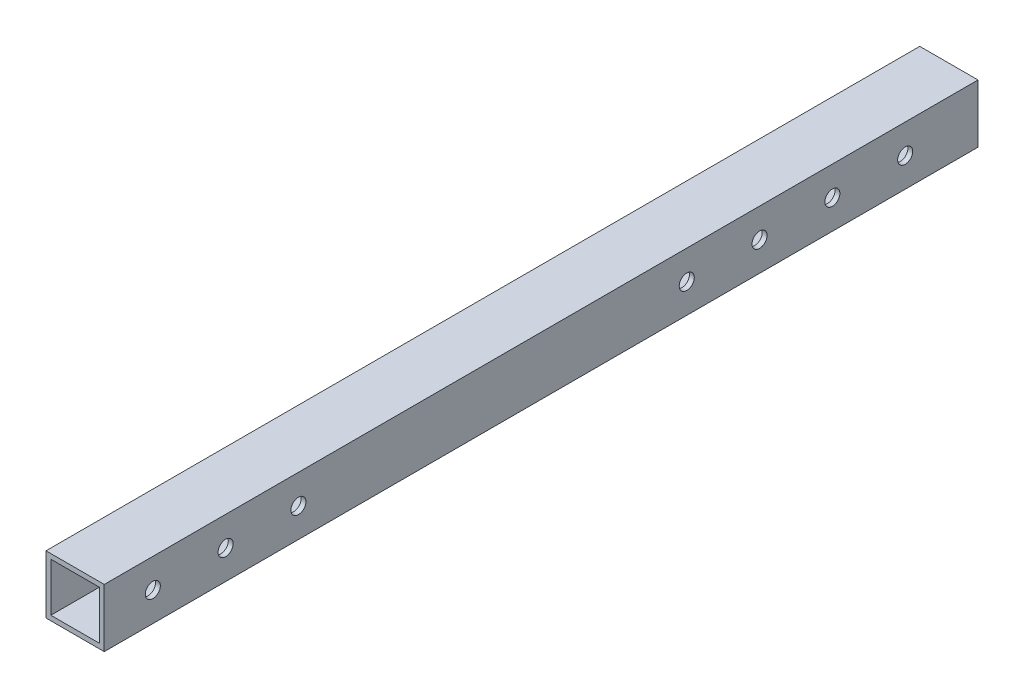
from build123d import *

# Parameters (mm, degrees)
SKETCH_1_W          = 12
SKETCH_1_H          = 12
SKETCH_1_W_2        = 10
SKETCH_1_H_2        = 10
EXTRUDE_1_DEPTH     = 180
SKETCH_3_R          = 1.55
CUT_EXTRUDE_1_DEPTH = 181.79823008


with BuildPart() as part:
    # 草图1 → 凸台-拉伸1 (new body)
    with BuildSketch(Plane.XY):
        with Locations((6, 6)):
            Rectangle(SKETCH_1_W, SKETCH_1_H)
        with Locations((6, 6)):
            Rectangle(SKETCH_1_W_2, SKETCH_1_H_2, mode=Mode.SUBTRACT)
    extrude(amount=EXTRUDE_1_DEPTH)

    # 草图3 → 切除-拉伸1 (cut, through all)
    with BuildSketch(Plane.YZ.offset(12)):
        with Locations((6, 30)):
            Circle(SKETCH_3_R)
        with Locations((6, 45)):
            Circle(SKETCH_3_R)
        with Locations((6, 60)):
            Circle(SKETCH_3_R)
        with Locations((6, 15)):
            Circle(SKETCH_3_R)
        with Locations((6, 170)):
            Circle(SKETCH_3_R)
        with Locations((6, 155)):
            Circle(SKETCH_3_R)
        with Locations((6, 140)):
            Circle(SKETCH_3_R)
    extrude(amount=-CUT_EXTRUDE_1_DEPTH, mode=Mode.SUBTRACT)


solid = part.part
